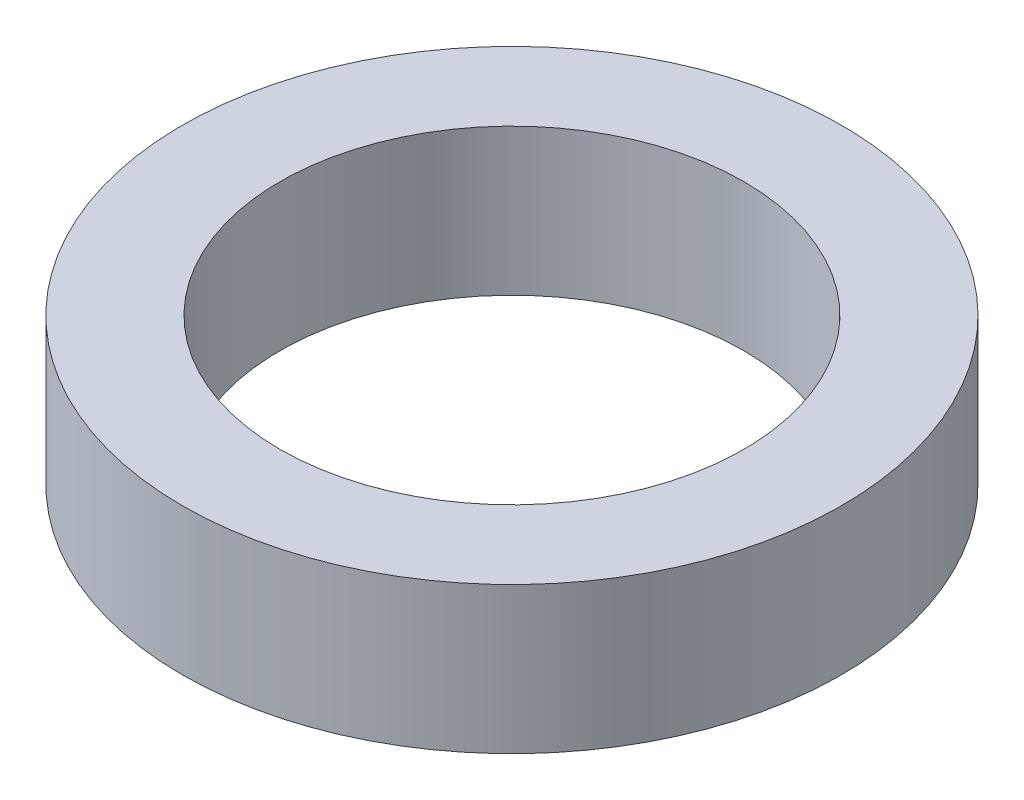
from build123d import *

# Parameters (mm, degrees)
SKETCH1_R           = 67.5
BOSS_EXTRUDE1_DEPTH = 30
SKETCH2_R           = 47.5
CUT_EXTRUDE1_DEPTH  = 101.062480481


with BuildPart() as part:
    # Sketch1 → Boss-Extrude1 (new body)
    with BuildSketch(Plane(origin=(0, 0, 0), x_dir=(1, 0, 0), z_dir=(0, 1, 0))):
        Circle(SKETCH1_R)
    extrude(amount=BOSS_EXTRUDE1_DEPTH)

    # Sketch2 → Cut-Extrude1 (cut, through all)
    with BuildSketch(Plane(origin=(0, 0, 0), x_dir=(1, 0, 0), z_dir=(0, 1, 0))):
        Circle(SKETCH2_R)
    extrude(amount=CUT_EXTRUDE1_DEPTH, mode=Mode.SUBTRACT)


solid = part.part
